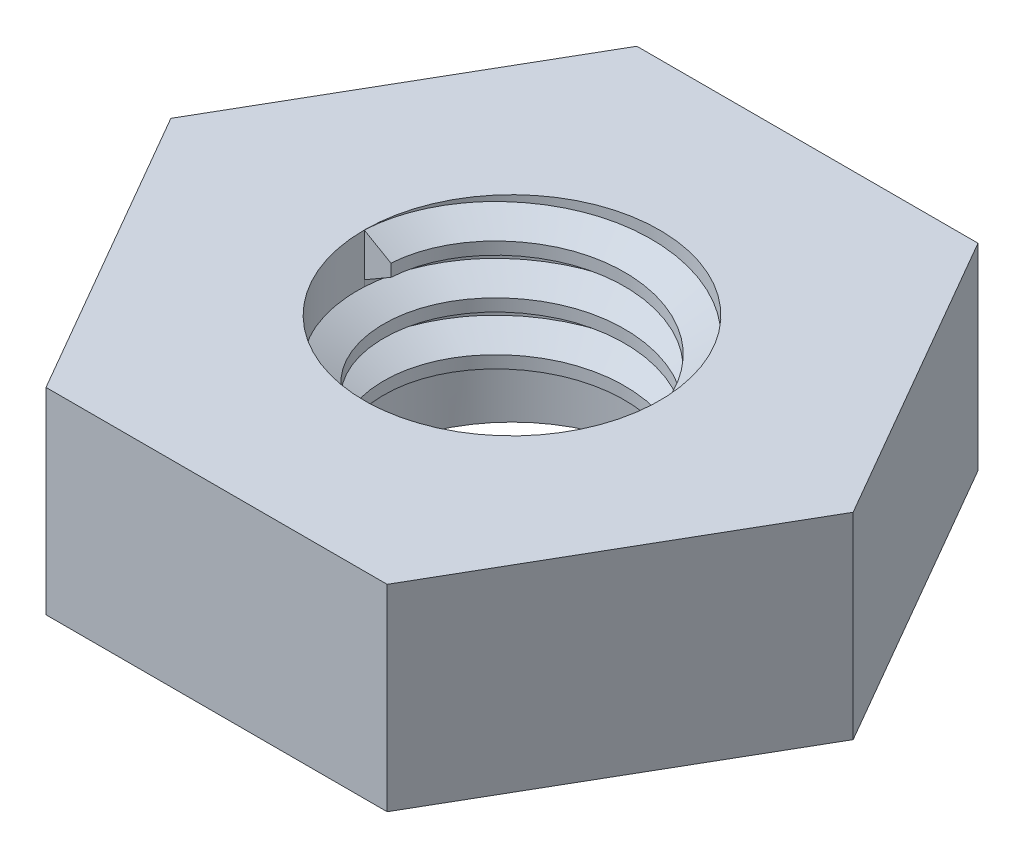
from build123d import *

# Parameters (mm, degrees)
SKETCH_1_R      = 1.5
EXTRUDE_1_DEPTH = 2
THREAD_1_PITCH  = 0.5


with BuildPart() as part:
    # Sketch 1 → 填料-伸長1 (new body)
    with BuildSketch(Plane(origin=(0, 0, 0), x_dir=(1, 0, 0), z_dir=(0, 1, 0))):
        Polygon((3.464101615, 0), (1.732050808, 3), (-1.732050808, 3), (-3.464101615, 0), (-1.732050808, -3), (1.732050808, -3), align=None)
        with Locations(Location((0, 0, 0), (0, 0, 270))):
            Circle(SKETCH_1_R, mode=Mode.SUBTRACT)
    extrude(amount=EXTRUDE_1_DEPTH)

    # 螺紋1: the profile of Sketch 1 2 profile screwed along a right-hand helix of 3 turns, 6 arcs to a turn; built about Z, then put on its axis
    thread_1_z = Axis((0, 0, 0), (0, 0, 1))
    thread_1_corners = [(1.5006, 0, -0.00034641), (1.5006, 0, 0.437846409), (1.229367063, 0, 0.281249999), (1.229367063, 0, 0.156249999)]
    with BuildLine(mode=Mode.PRIVATE) as thread_1_profile:
        Line(thread_1_corners[0], thread_1_corners[1])
        Line(thread_1_corners[1], thread_1_corners[2])
        Line(thread_1_corners[2], thread_1_corners[3])
        Line(thread_1_corners[3], thread_1_corners[0])
    thread_1_cap = Face(thread_1_profile.wire())
    thread_1_turn_angles = [0, 30, 60, 90, 120, 150, 180, 210, 240, 270, 300, 330, 360]
    thread_1_turn_weights = [1, 0.8660254037844387, 1, 0.8660254037844387, 1, 0.8660254037844387, 1, 0.8660254037844387, 1, 0.8660254037844387, 1, 0.8660254037844387, 1]
    thread_1_turn_rails = [Edge.make_bspline([Vector(p[0], p[1], 0).rotate(thread_1_z, thread_1_turn_angles[k]) / thread_1_turn_weights[k] + Vector(0, 0, p[2] + THREAD_1_PITCH * thread_1_turn_angles[k] / 360) for k in range(13)], [0, 0, 0, 1, 1, 2, 2, 3, 3, 4, 4, 5, 5, 6, 6, 6], 2, thread_1_turn_weights) for p in thread_1_corners]
    thread_1_turn_sides = [Face.make_surface_from_curves(thread_1_turn_rails[p[0]], thread_1_turn_rails[p[1]]) for p in [(0, 1), (1, 2), (2, 3), (3, 0)]]
    thread_1 = Plane(origin=(0, 2, 0), x_dir=(-1, 0, 0), z_dir=(0, -1, 0)) * Solid(Shell([*[p.moved(Location((0, 0, THREAD_1_PITCH * i))) for i in range(3) for p in thread_1_turn_sides], thread_1_cap, thread_1_cap.rotate(thread_1_z, 1080).moved(Location((0, 0, THREAD_1_PITCH * 1080 / 360)))]))
    add(thread_1)


solid = part.part
